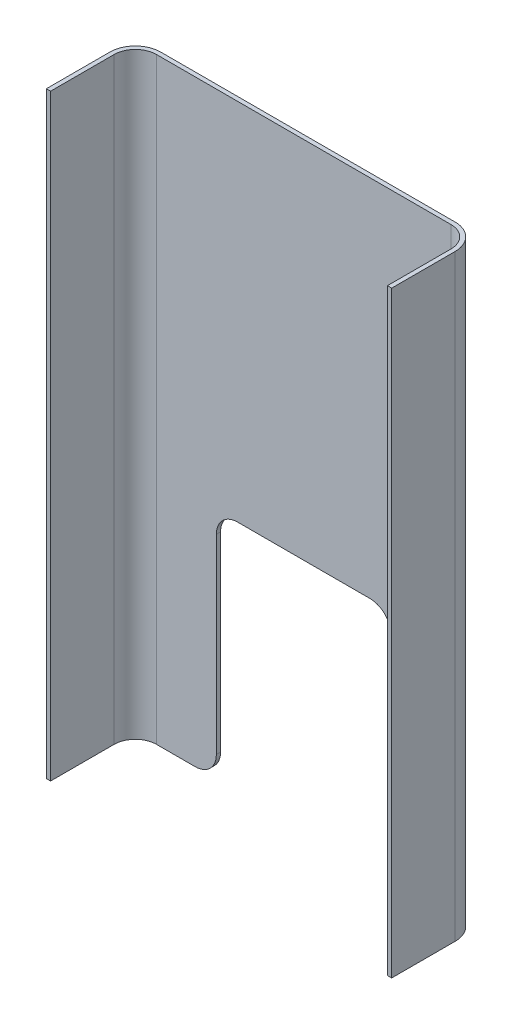
from build123d import *

# Parameters (mm, degrees)
EXTRUDE_THIN1_DEPTH     = 564
CUT_EXTRUDE2_DEPTH      = 594.060705156
CUT_EXTRUDE2_DEPTH_BACK = 594.060705156
SKETCH3_W               = 165
SKETCH3_H               = 220
FILLET1_R               = 20


with BuildPart() as part:
    # Sketch1 → Extrude-Thin1 (new body)
    with BuildSketch(Plane(origin=(0, 0, 0), x_dir=(1, 0, 0), z_dir=(0, 1, 0))):
        with BuildLine():
            Line((-159, -80), (-159, -20))
            ThreePointArc((-159, -20), (-153.142135624, -5.857864376), (-139, 0))
            Line((-139, 0), (139, 0))
            ThreePointArc((139, 0), (153.142135624, -5.857864376), (159, -20))
            Line((159, -20), (159, -80))
            Line((159, -80), (163, -80))
            Line((163, -80), (163, -20))
            ThreePointArc((163, -20), (155.970562748, -3.029437252), (139, 4))
            Line((139, 4), (-139, 4))
            ThreePointArc((-139, 4), (-155.970562748, -3.029437252), (-163, -20))
            Line((-163, -20), (-163, -80))
            Line((-163, -80), (-159, -80))
        make_face()
    extrude(amount=EXTRUDE_THIN1_DEPTH)

    # Sketch3 → Cut-Extrude2 (cut, two sides: drawn at the far end of the back side and taken through both)
    with BuildSketch(Plane(origin=(0, 0, -4), x_dir=(-1, 0, 0), z_dir=(0, 0, -1)).offset(-CUT_EXTRUDE2_DEPTH_BACK)):
        with Locations((0, 110)):
            Rectangle(SKETCH3_W, SKETCH3_H)
    extrude(amount=CUT_EXTRUDE2_DEPTH + CUT_EXTRUDE2_DEPTH_BACK, mode=Mode.SUBTRACT)

    # Fillet1
    fillet1_edges = [part.edges().sort_by_distance(p)[0] for p in [
        (82.5, 220, -2),
        (-82.5, 220, -2),
        (-82.5, 0, -2),
        (82.5, 0, -2),
    ]]
    fillet(fillet1_edges, radius=FILLET1_R)


solid = part.part
